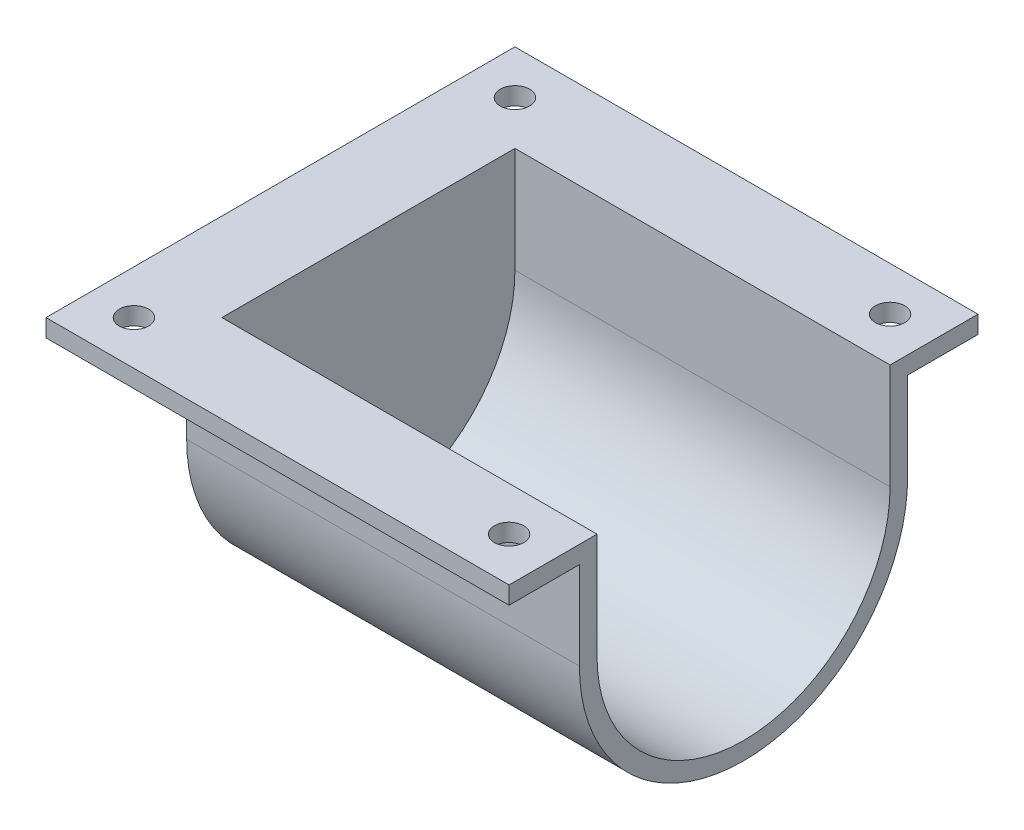
from build123d import *

# Parameters (mm, degrees)
TUBE_CLAMP_BASE_EXTRUDE_DEPTH           = 67
TUBE_CLAMP_MOUNTING_PLATE_EXTRUDE_DEPTH = 79
INNER_START                             = -64
INNER_SHELL_DEPTH                       = 64
F_5_0MM_DOWEL_HOLE1_D                   = 5


# Read off the part's stored shape, not the designer's step: Inner Shell
with BuildPart() as part:
    # Tube Clamp Profile → Tube Clamp Base Extrude (new body)
    with BuildSketch(Plane(origin=(0, 0, 0), x_dir=(0, 0, -1), z_dir=(1, 0, 0))):
        with BuildLine():
            Line((-28, 15), (-28, 0))
            ThreePointArc((-28, 0), (0, -28), (28, 0))
            Line((28, 0), (28, 15))
            Line((28, 15), (-28, 15))
        make_face()
    extrude(amount=-TUBE_CLAMP_BASE_EXTRUDE_DEPTH)

    # Sketch1<3> → Tube Clamp Mounting Plate Extrude (add)
    with BuildSketch(Plane(origin=(0, 0, 0), x_dir=(0, 0, -1), z_dir=(1, 0, 0))):
        Polygon((40, 15), (40, 18), (-40, 18), (-40, 15), (-28, 15), (28, 15), align=None)
    extrude(amount=-TUBE_CLAMP_MOUNTING_PLATE_EXTRUDE_DEPTH)

    # Inner Shell outline → Inner Shell (cut)
    with BuildSketch(Plane.YZ.offset(INNER_START)):
        with BuildLine():
            Line((18, -25), (18, 25))
            Line((18, 25), (0, 25))
            ThreePointArc((0, 25), (-25, 0), (0, -25))
            Line((0, -25), (18, -25))
        make_face()
    extrude(amount=INNER_SHELL_DEPTH, mode=Mode.SUBTRACT)

    # Ø5.0mm Dowel Hole1 (through all)
    with Locations(Plane.XZ):
        with Locations((-7.5, -32.5), (-71.5, 32.5), (-7.5, 32.5), (-71.5, -32.5)):
            Hole(F_5_0MM_DOWEL_HOLE1_D / 2)


solid = part.part
